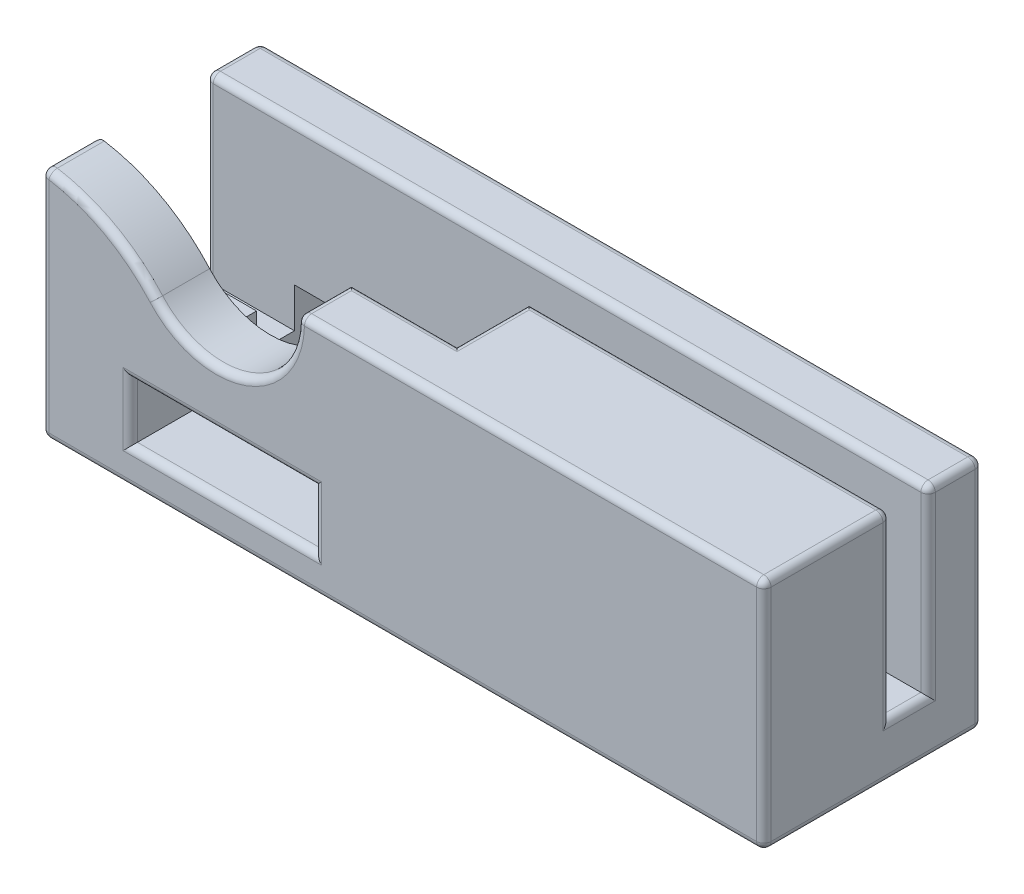
from build123d import *

# Parameters (mm, degrees)
SKETCH1_W           = 40
SKETCH1_H           = 12.1
BOSS_EXTRUDE1_DEPTH = 3
SKETCH2_W           = 40
SKETCH2_H           = 3
SKETCH2_H_2         = 7
BOSS_EXTRUDE2_DEPTH = 10
SKETCH3_W           = 10.2
SKETCH3_H           = 3.2
CUT_EXTRUDE1_DEPTH  = 44.765397291
SKETCH4_W           = 4
SKETCH4_H           = 8
CUT_EXTRUDE2_DEPTH  = 20
SKETCH5_R           = 4.5
CUT_EXTRUDE3_DEPTH  = 3
FILLET2_R           = 10
FILLET1_R           = 0.4


with BuildPart() as part:
    # Sketch1 → Boss-Extrude1 (new body)
    with BuildSketch(Plane(origin=(0, 0, 0), x_dir=(1, 0, 0), z_dir=(0, 1, 0))):
        with Locations((20, -6.05)):
            Rectangle(SKETCH1_W, SKETCH1_H)
    extrude(amount=BOSS_EXTRUDE1_DEPTH)

    # Sketch2 → Boss-Extrude2 (add)
    with BuildSketch(Plane(origin=(0, 3, 0), x_dir=(1, 0, 0), z_dir=(0, 1, 0))):
        with Locations((20, -1.5)):
            Rectangle(SKETCH2_W, SKETCH2_H)
        with Locations((20, -8.6)):
            Rectangle(SKETCH2_W, SKETCH2_H_2)
    extrude(amount=BOSS_EXTRUDE2_DEPTH)

    # Sketch3 → Cut-Extrude1 (cut, through all)
    with BuildSketch(Plane(origin=(0, 0, 0), x_dir=(-1, 0, 0), z_dir=(0, 0, -1))):
        with Locations((-10, 3.6)):
            Rectangle(SKETCH3_W, SKETCH3_H)
    extrude(amount=-CUT_EXTRUDE1_DEPTH, mode=Mode.SUBTRACT)

    # Sketch4 → Cut-Extrude2 (cut)
    with BuildSketch(Plane.ZY):
        with Locations((7.1, 9)):
            Rectangle(SKETCH4_W, SKETCH4_H)
    extrude(amount=-CUT_EXTRUDE2_DEPTH, mode=Mode.SUBTRACT)

    # Sketch5 → Cut-Extrude3 (cut)
    with BuildSketch(Plane.XY.offset(12.1)):
        with Locations((9.655746404, 12.73)):
            Circle(SKETCH5_R)
    extrude(amount=-CUT_EXTRUDE3_DEPTH, mode=Mode.SUBTRACT)

    # Fillet2
    # the kernel refuses this fillet: 10 mm, written as the material it takes off along each edge
    with BuildSketch(Plane(origin=(5.163853707, 13, 9.1), x_dir=(0.32846589208199206, -0.9445158324447405, 0), z_dir=(0, 0, 1))) as fillet2_piece_1:
        with BuildLine():
            CenterArc((7.306356337, -9.231062175), FILLET2_R, 112.615500581, 41.575528471)
            Line((-1.696149814, -4.877341583), (0, 0))
            ThreePointArc((0, 0), (1.730452817, -0.346022021), (3.460905633, 0))
        make_face()
    extrude(amount=15.909634267, mode=Mode.SUBTRACT)

    # Fillet1
    fillet1_edges = [part.edges().sort_by_distance(p)[0] for p in [
        (0, 3, 4.05),
        (0, 8, 3),
        (40, 8, 3),
        (0, 13, 1.5),
        (20, 13, 3),
        (40, 13, 1.5),
        (20, 13, 0),
        (40, 3, 4.05),
        (40, 8, 5.1),
        (40, 13, 8.6),
        (30, 13, 5.1),
        (15.1, 3.6, 12.1),
        (10, 5.2, 12.1),
        (4.9, 3.6, 12.1),
        (10, 2, 12.1),
        (15.1, 3.6, 0),
        (10, 2, 0),
        (4.9, 3.6, 0),
        (20, 0, 0),
        (10, 5.2, 0),
        (40, 0, 6.05),
        (20, 0, 12.1),
        (0, 0, 6.05),
        (0, 13, 10.6),
        (0, 4, 5.1),
        (17.07381955, 13, 9.1),
        (20, 13, 7.1),
        (0, 5, 7.1),
        (0, 9, 9.1),
        (0, 6.5, 0),
        (40, 6.5, 0),
        (40, 6.5, 12.1),
        (0, 6.5, 12.1),
        (27.07381955, 13, 12.1),
        (14.147639101, 13, 10.6),
        (11.38619922, 8.576022021, 12.1),
        (3.450117075, 11.943404417, 12.1),
    ]]
    fillet(fillet1_edges, radius=FILLET1_R)


solid = part.part
